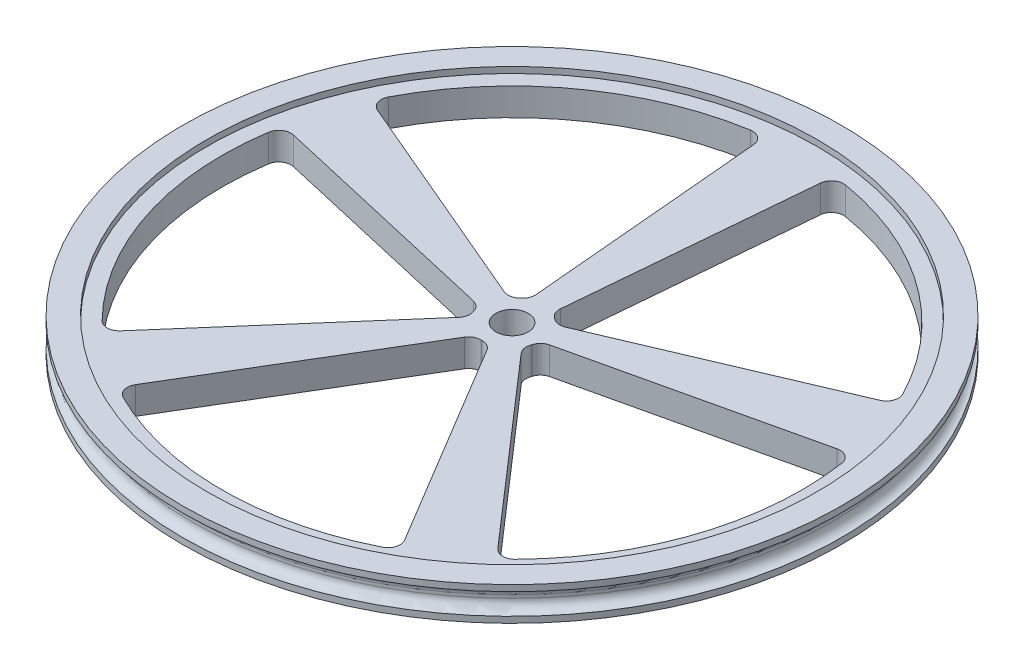
from build123d import *

# Parameters (mm, degrees)
SKETCH_2_R          = 52.5
SKETCH_2_R_2        = 2.65
EXTRUDE_1_DEPTH     = 2.75
SKETCH_3_R          = 54
SKETCH_3_R_2        = 52.5
EXTRUDE_2_DEPTH     = 1
SKETCH_4_R          = 50
SKETCH_4_R_2        = 2.65
CUT_EXTRUDE_1_DEPTH = 1
FILLET_1_R          = 1.5


with BuildPart() as part:
    # 草图2 → 凸台-拉伸1 (new, symmetric)
    with BuildSketch(Plane(origin=(0, 0, 0), x_dir=(1, 0, 0), z_dir=(0, 1, 0))):
        with Locations(Location((0, 0, 0), (0, 0, 270))):
            Circle(SKETCH_2_R)
        with Locations(Location((0, 0, 0), (0, 0, 270))):
            Circle(SKETCH_2_R_2, mode=Mode.SUBTRACT)
        with BuildLine():
            Line((-5.104760308, -3.608479293), (-30.908533356, -33.241423952))
            ThreePointArc((-30.908533356, -33.241423952), (-32.355479798, -33.927082172), (-33.841752753, -33.331453173))
            ThreePointArc((-33.841752753, -33.331453173), (-45.175184524, -14.678307233), (-46.970289709, 7.074028884))
            ThreePointArc((-46.970289709, 7.074028884), (-46.117971572, 8.42951219), (-44.544347521, 8.725296818))
            Line((-44.544347521, 8.725296818), (-6.250848753, -0.081181754))
            ThreePointArc((-6.250848753, -0.081181754), (-5.333939805, -0.568676849), (-4.785067523, -1.450216811))
            ThreePointArc((-4.785067523, -1.450216811), (-4.755282581, -1.545084972), (-4.723617, -1.639342075))
            ThreePointArc((-4.723617, -1.639342075), (-4.649507815, -2.675141919), (-5.104760308, -3.608479293))
        make_face(mode=Mode.SUBTRACT)
        with BuildLine():
            Line((-5.009325433, 3.73983413), (-41.165734939, 19.123597139))
            ThreePointArc((-41.165734939, 19.123597139), (-42.264965697, 20.287844939), (-42.157772458, 21.885434001))
            ThreePointArc((-42.157772458, 21.885434001), (-27.919799484, 38.428307233), (-7.786816484, 46.857395244))
            ThreePointArc((-7.786816484, 46.857395244), (-6.234294464, 46.465659903), (-5.466709992, 45.060456971))
            Line((-5.466709992, 45.060456971), (-2.00882693, 5.919823897))
            ThreePointArc((-2.00882693, 5.919823897), (-2.18912187, 4.897147398), (-2.857905332, 4.102728009))
            ThreePointArc((-2.857905332, 4.102728009), (-2.938926261, 4.045084972), (-3.018784891, 3.985842167))
            ThreePointArc((-3.018784891, 3.985842167), (-3.980988084, 3.595280389), (-5.009325433, 3.73983413))
        make_face(mode=Mode.SUBTRACT)
        with BuildLine():
            Line((1.854410058, -5.96999698), (22.063210783, -39.667926976))
            ThreePointArc((22.063210783, -39.667926976), (22.26817946, -41.255934861), (21.242419017, -42.485404956))
            ThreePointArc((21.242419017, -42.485404956), (0, -47.5), (-21.242419017, -42.485404956))
            ThreePointArc((-21.242419017, -42.485404956), (-22.26817946, -41.255934861), (-22.063210783, -39.667926976))
            Line((-22.063210783, -39.667926976), (-1.854410058, -5.96999698))
            ThreePointArc((-1.854410058, -5.96999698), (-1.107434224, -5.24860902), (-0.099429036, -4.999011289))
            ThreePointArc((-0.099429036, -4.999011289), (0, -5), (0.099429036, -4.999011289))
            ThreePointArc((0.099429036, -4.999011289), (1.107434224, -5.24860902), (1.854410058, -5.96999698))
        make_face(mode=Mode.SUBTRACT)
        with BuildLine():
            Line((6.250848753, -0.081181754), (44.544347521, 8.725296818))
            ThreePointArc((44.544347521, 8.725296818), (46.117971572, 8.42951219), (46.970289709, 7.074028884))
            ThreePointArc((46.970289709, 7.074028884), (45.175184524, -14.678307233), (33.841752753, -33.331453173))
            ThreePointArc((33.841752753, -33.331453173), (32.355479798, -33.927082172), (30.908533356, -33.241423952))
            Line((30.908533356, -33.241423952), (5.104760308, -3.608479293))
            ThreePointArc((5.104760308, -3.608479293), (4.649507815, -2.675141919), (4.723617, -1.639342075))
            ThreePointArc((4.723617, -1.639342075), (4.755282581, -1.545084972), (4.785067523, -1.450216811))
            ThreePointArc((4.785067523, -1.450216811), (5.333939805, -0.568676849), (6.250848753, -0.081181754))
        make_face(mode=Mode.SUBTRACT)
        with BuildLine():
            Line((2.00882693, 5.919823897), (5.466709992, 45.060456971))
            ThreePointArc((5.466709992, 45.060456971), (6.234294464, 46.465659903), (7.786816484, 46.857395244))
            ThreePointArc((7.786816484, 46.857395244), (27.919799484, 38.428307233), (42.157772458, 21.885434001))
            ThreePointArc((42.157772458, 21.885434001), (42.264965697, 20.287844939), (41.165734939, 19.123597139))
            Line((41.165734939, 19.123597139), (5.009325433, 3.73983413))
            ThreePointArc((5.009325433, 3.73983413), (3.980988084, 3.595280389), (3.018784891, 3.985842167))
            ThreePointArc((3.018784891, 3.985842167), (2.938926261, 4.045084972), (2.857905332, 4.102728009))
            ThreePointArc((2.857905332, 4.102728009), (2.18912187, 4.897147398), (2.00882693, 5.919823897))
        make_face(mode=Mode.SUBTRACT)
    extrude(amount=EXTRUDE_1_DEPTH, both=True)

    # 草图3 → 凸台-拉伸2 (add)
    with BuildSketch(Plane(origin=(0, 2.75, 0), x_dir=(1, 0, 0), z_dir=(0, 1, 0))):
        with Locations(Location((0, 0, 0), (0, 0, 270))):
            Circle(SKETCH_3_R)
        with Locations(Location((0, 0, 0), (0, 0, 270))):
            Circle(SKETCH_3_R_2, mode=Mode.SUBTRACT)
    extrude_2 = extrude(amount=-EXTRUDE_2_DEPTH)

    # 草图4 → 切除-拉伸1 (cut)
    with BuildSketch(Plane(origin=(0, 2.75, 0), x_dir=(1, 0, 0), z_dir=(0, 1, 0))):
        with Locations(Location((0, 0, 0), (0, 0, 270))):
            Circle(SKETCH_4_R)
        with Locations(Location((0, 0, 0), (0, 0, 270))):
            Circle(SKETCH_4_R_2, mode=Mode.SUBTRACT)
        with BuildLine():
            Line((41.165734939, 19.123597139), (5.009325433, 3.73983413))
            ThreePointArc((5.009325433, 3.73983413), (3.980988084, 3.595280389), (3.018784891, 3.985842167))
            ThreePointArc((3.018784891, 3.985842167), (2.938926261, 4.045084972), (2.857905332, 4.102728009))
            ThreePointArc((2.857905332, 4.102728009), (2.18912187, 4.897147398), (2.00882693, 5.919823897))
            Line((2.00882693, 5.919823897), (5.466709992, 45.060456971))
            ThreePointArc((5.466709992, 45.060456971), (6.234294464, 46.465659903), (7.786816484, 46.857395244))
            ThreePointArc((7.786816484, 46.857395244), (27.919799484, 38.428307233), (42.157772458, 21.885434001))
            ThreePointArc((42.157772458, 21.885434001), (42.264965697, 20.287844939), (41.165734939, 19.123597139))
        make_face(mode=Mode.SUBTRACT)
        with BuildLine():
            Line((30.908533356, -33.241423952), (5.104760308, -3.608479293))
            ThreePointArc((5.104760308, -3.608479293), (4.649507815, -2.675141919), (4.723617, -1.639342075))
            ThreePointArc((4.723617, -1.639342075), (4.755282581, -1.545084972), (4.785067523, -1.450216811))
            ThreePointArc((4.785067523, -1.450216811), (5.333939805, -0.568676849), (6.250848753, -0.081181754))
            Line((6.250848753, -0.081181754), (44.544347521, 8.725296818))
            ThreePointArc((44.544347521, 8.725296818), (46.117971572, 8.42951219), (46.970289709, 7.074028884))
            ThreePointArc((46.970289709, 7.074028884), (45.175184524, -14.678307233), (33.841752753, -33.331453173))
            ThreePointArc((33.841752753, -33.331453173), (32.355479798, -33.927082172), (30.908533356, -33.241423952))
        make_face(mode=Mode.SUBTRACT)
        with BuildLine():
            Line((-22.063210783, -39.667926976), (-1.854410058, -5.96999698))
            ThreePointArc((-1.854410058, -5.96999698), (-1.107434224, -5.24860902), (-0.099429036, -4.999011289))
            ThreePointArc((-0.099429036, -4.999011289), (0, -5), (0.099429036, -4.999011289))
            ThreePointArc((0.099429036, -4.999011289), (1.107434224, -5.24860902), (1.854410058, -5.96999698))
            Line((1.854410058, -5.96999698), (22.063210783, -39.667926976))
            ThreePointArc((22.063210783, -39.667926976), (22.26817946, -41.255934861), (21.242419017, -42.485404956))
            ThreePointArc((21.242419017, -42.485404956), (0, -47.5), (-21.242419017, -42.485404956))
            ThreePointArc((-21.242419017, -42.485404956), (-22.26817946, -41.255934861), (-22.063210783, -39.667926976))
        make_face(mode=Mode.SUBTRACT)
        with BuildLine():
            Line((-44.544347521, 8.725296818), (-6.250848753, -0.081181754))
            ThreePointArc((-6.250848753, -0.081181754), (-5.333939805, -0.568676849), (-4.785067523, -1.450216811))
            ThreePointArc((-4.785067523, -1.450216811), (-4.755282581, -1.545084972), (-4.723617, -1.639342075))
            ThreePointArc((-4.723617, -1.639342075), (-4.649507815, -2.675141919), (-5.104760308, -3.608479293))
            Line((-5.104760308, -3.608479293), (-30.908533356, -33.241423952))
            ThreePointArc((-30.908533356, -33.241423952), (-32.355479798, -33.927082172), (-33.841752753, -33.331453173))
            ThreePointArc((-33.841752753, -33.331453173), (-45.175184524, -14.678307233), (-46.970289709, 7.074028884))
            ThreePointArc((-46.970289709, 7.074028884), (-46.117971572, 8.42951219), (-44.544347521, 8.725296818))
        make_face(mode=Mode.SUBTRACT)
        with BuildLine():
            ThreePointArc((-7.786816484, 46.857395244), (-6.234294464, 46.465659903), (-5.466709992, 45.060456971))
            Line((-5.466709992, 45.060456971), (-2.00882693, 5.919823897))
            ThreePointArc((-2.00882693, 5.919823897), (-2.18912187, 4.897147398), (-2.857905332, 4.102728009))
            ThreePointArc((-2.857905332, 4.102728009), (-2.938926261, 4.045084972), (-3.018784891, 3.985842167))
            ThreePointArc((-3.018784891, 3.985842167), (-3.980988084, 3.595280389), (-5.009325433, 3.73983413))
            Line((-5.009325433, 3.73983413), (-41.165734939, 19.123597139))
            ThreePointArc((-41.165734939, 19.123597139), (-42.264965697, 20.287844939), (-42.157772458, 21.885434001))
            ThreePointArc((-42.157772458, 21.885434001), (-27.919799484, 38.428307233), (-7.786816484, 46.857395244))
        make_face(mode=Mode.SUBTRACT)
    extrude(amount=-CUT_EXTRUDE_1_DEPTH, mode=Mode.SUBTRACT)

    # 镜向1: 凸台-拉伸2 across plane
    add(extrude_2.mirror(Plane.ZX))

    # 圆角1
    fillet_1_edges = [part.edges().sort_by_distance(p)[0] for p in [
        (0, 1.75, -52.5),
        (0, -1.75, -52.5),
    ]]
    fillet(fillet_1_edges, radius=FILLET_1_R - 0.0001)  # a hair under: the kernel refuses the full size


solid = part.part
